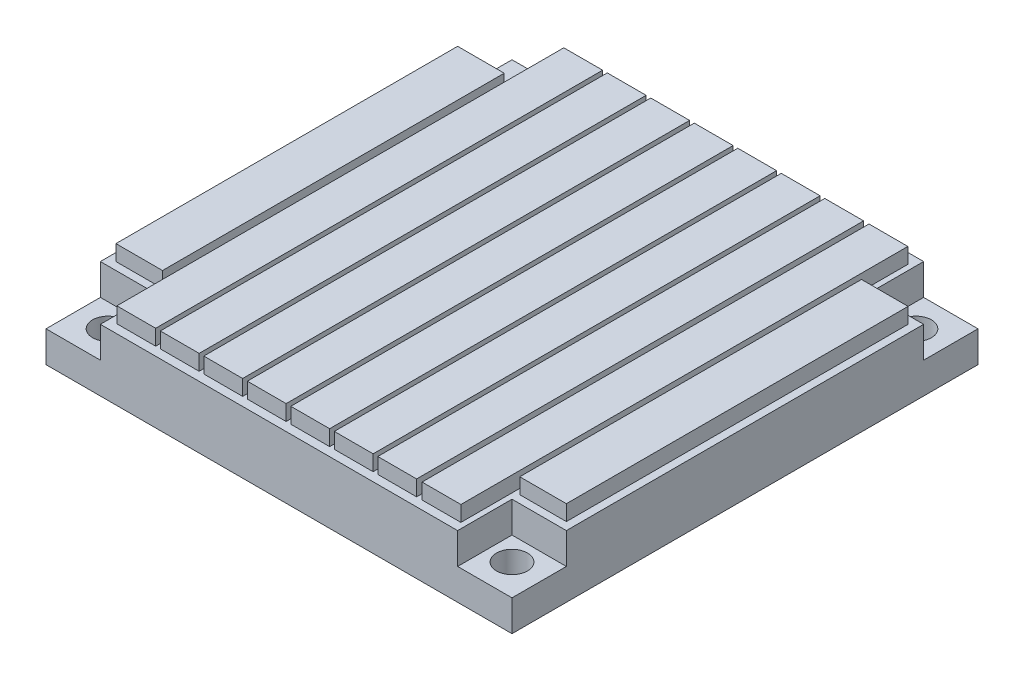
from build123d import *

# Parameters (mm, degrees)
SKETCH1_W                   = 30
SKETCH1_H                   = 30
BOSS_EXTRUDE1_DEPTH         = 4
CUT_EXTRUDE_THIN2_START     = -2
CUT_EXTRUDE_THIN2_OUTLINE_W = 3.5
CUT_EXTRUDE_THIN2_OUTLINE_H = 3.5
CUT_EXTRUDE_THIN2_DEPTH     = 2
SKETCH6_W                   = 3
SKETCH6_H                   = 22
BOSS_EXTRUDE2_DEPTH         = 1
SKETCH6_W_2                 = 2.5
SKETCH6_H_2                 = 28.774594564
BOSS_EXTRUDE2_2_DEPTH       = 1
BOSS_EXTRUDE2_3_DEPTH       = 1
BOSS_EXTRUDE2_4_DEPTH       = 1
BOSS_EXTRUDE2_5_DEPTH       = 1
BOSS_EXTRUDE2_6_DEPTH       = 1
BOSS_EXTRUDE2_7_DEPTH       = 1
BOSS_EXTRUDE2_8_DEPTH       = 1
BOSS_EXTRUDE2_9_DEPTH       = 1
BOSS_EXTRUDE2_10_DEPTH      = 1
SKETCH7_R                   = 1
CUT_EXTRUDE1_DEPTH          = 22.794494718


# Read off the part's stored shape, not the designer's step: Cut-Extrude-Thin2
with BuildPart() as part:
    # Sketch1 → Boss-Extrude1 (new body)
    with BuildSketch(Plane(origin=(0, 0, 0), x_dir=(1, 0, 0), z_dir=(0, 1, 0))):
        Rectangle(SKETCH1_W, SKETCH1_H)
    extrude(amount=BOSS_EXTRUDE1_DEPTH)

    # Cut-Extrude-Thin2 outline → Cut-Extrude-Thin2 (cut)
    with BuildSketch(Plane(origin=(0, 4, 0), x_dir=(1, 0, 0), z_dir=(0, 1, 0)).offset(CUT_EXTRUDE_THIN2_START)):
        with Locations((-13.25, -13.25)):
            Rectangle(CUT_EXTRUDE_THIN2_OUTLINE_W, CUT_EXTRUDE_THIN2_OUTLINE_H)
        with Locations((13.25, -13.25)):
            Rectangle(CUT_EXTRUDE_THIN2_OUTLINE_W, CUT_EXTRUDE_THIN2_OUTLINE_H)
        with Locations((-13.25, 13.25)):
            Rectangle(CUT_EXTRUDE_THIN2_OUTLINE_W, CUT_EXTRUDE_THIN2_OUTLINE_H)
        with Locations((13.25, 13.25)):
            Rectangle(CUT_EXTRUDE_THIN2_OUTLINE_W, CUT_EXTRUDE_THIN2_OUTLINE_H)
    extrude(amount=CUT_EXTRUDE_THIN2_DEPTH, mode=Mode.SUBTRACT)

    # Sketch7 → Cut-Extrude1 (cut, through all)
    with BuildSketch(Plane.XZ):
        with Locations(Location((-13, 13, 0), (0, 0, 270))):
            Circle(SKETCH7_R)
        with Locations(Location((13, 13, 0), (0, 0, 90))):
            Circle(SKETCH7_R)
        with Locations(Location((13, -13, 0), (0, 0, 270))):
            Circle(SKETCH7_R)
        with Locations(Location((-13, -13, 0), (0, 0, 90))):
            Circle(SKETCH7_R)
    extrude(amount=-CUT_EXTRUDE1_DEPTH, mode=Mode.SUBTRACT)


with BuildPart() as body_2:
    # Sketch6 → Boss-Extrude2 (new body)
    with BuildSketch(Plane(origin=(0, 4, 0), x_dir=(1, 0, 0), z_dir=(0, 1, 0))):
        with Locations((-13, 0)):
            Rectangle(SKETCH6_W, SKETCH6_H)
    extrude(amount=BOSS_EXTRUDE2_DEPTH)


with BuildPart() as body_3:
    # Sketch6 → Boss-Extrude2 2 (new body)
    with BuildSketch(Plane(origin=(0, 4, 0), x_dir=(1, 0, 0), z_dir=(0, 1, 0))):
        with Locations((-9.75, -0.052758691)):
            Rectangle(SKETCH6_W_2, SKETCH6_H_2)
    extrude(amount=BOSS_EXTRUDE2_2_DEPTH)


with BuildPart() as body_4:
    # Sketch6 → Boss-Extrude2 3 (new body)
    with BuildSketch(Plane(origin=(0, 4, 0), x_dir=(1, 0, 0), z_dir=(0, 1, 0))):
        with Locations((-6.95, -0.052758691)):
            Rectangle(SKETCH6_W_2, SKETCH6_H_2)
    extrude(amount=BOSS_EXTRUDE2_3_DEPTH)


with BuildPart() as body_5:
    # Sketch6 → Boss-Extrude2 4 (new body)
    with BuildSketch(Plane(origin=(0, 4, 0), x_dir=(1, 0, 0), z_dir=(0, 1, 0))):
        with Locations((-4.15, -0.052758691)):
            Rectangle(SKETCH6_W_2, SKETCH6_H_2)
    extrude(amount=BOSS_EXTRUDE2_4_DEPTH)


with BuildPart() as body_6:
    # Sketch6 → Boss-Extrude2 5 (new body)
    with BuildSketch(Plane(origin=(0, 4, 0), x_dir=(1, 0, 0), z_dir=(0, 1, 0))):
        with Locations((-1.35, -0.052758691)):
            Rectangle(SKETCH6_W_2, SKETCH6_H_2)
    extrude(amount=BOSS_EXTRUDE2_5_DEPTH)


with BuildPart() as body_7:
    # Sketch6 → Boss-Extrude2 6 (new body)
    with BuildSketch(Plane(origin=(0, 4, 0), x_dir=(1, 0, 0), z_dir=(0, 1, 0))):
        with Locations((1.45, -0.052758691)):
            Rectangle(SKETCH6_W_2, SKETCH6_H_2)
    extrude(amount=BOSS_EXTRUDE2_6_DEPTH)


with BuildPart() as body_8:
    # Sketch6 → Boss-Extrude2 7 (new body)
    with BuildSketch(Plane(origin=(0, 4, 0), x_dir=(1, 0, 0), z_dir=(0, 1, 0))):
        with Locations((4.25, -0.052758691)):
            Rectangle(SKETCH6_W_2, SKETCH6_H_2)
    extrude(amount=BOSS_EXTRUDE2_7_DEPTH)


with BuildPart() as body_9:
    # Sketch6 → Boss-Extrude2 8 (new body)
    with BuildSketch(Plane(origin=(0, 4, 0), x_dir=(1, 0, 0), z_dir=(0, 1, 0))):
        Polygon((8.3, -14.440055973), (8.3, 14.334538591), (7.713421102, 14.334538591), (5.8, 14.334538591), (5.8, -14.440055973), (7.713421102, -14.440055973), align=None)
    extrude(amount=BOSS_EXTRUDE2_8_DEPTH)


with BuildPart() as body_10:
    # Sketch6 → Boss-Extrude2 9 (new body)
    with BuildSketch(Plane(origin=(0, 4, 0), x_dir=(1, 0, 0), z_dir=(0, 1, 0))):
        Polygon((10.88715437, 14.334538591), (8.65, 14.334538591), (8.65, -14.440055973), (11.15, -14.440055973), (11.15, 14.334538591), align=None)
    extrude(amount=BOSS_EXTRUDE2_9_DEPTH)


with BuildPart() as body_11:
    # Sketch6 → Boss-Extrude2 10 (new body)
    with BuildSketch(Plane(origin=(0, 4, 0), x_dir=(1, 0, 0), z_dir=(0, 1, 0))):
        with Locations((13, 0)):
            Rectangle(SKETCH6_W, SKETCH6_H)
    extrude(amount=BOSS_EXTRUDE2_10_DEPTH)


solid = Compound([part.part, body_2.part, body_3.part, body_4.part, body_5.part, body_6.part, body_7.part, body_8.part, body_9.part, body_10.part, body_11.part])
